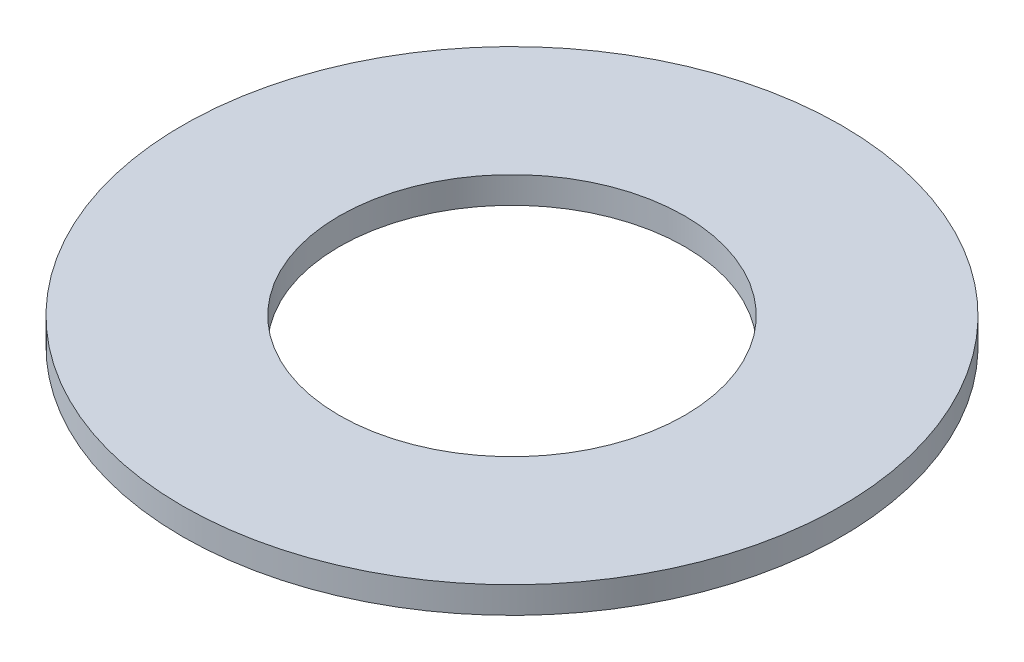
from build123d import *

# Parameters (mm, degrees)
SKETCH1_W = 29.5
SKETCH1_H = 5


with BuildPart() as part:
    # Sketch1 → Revolve1 (revolve)
    with BuildSketch(Plane.XY):
        with Locations((47.25, 0)):
            Rectangle(SKETCH1_W, SKETCH1_H)
    revolve(axis=Axis((0, 0, 0), (0, 1, 0)))


solid = part.part
